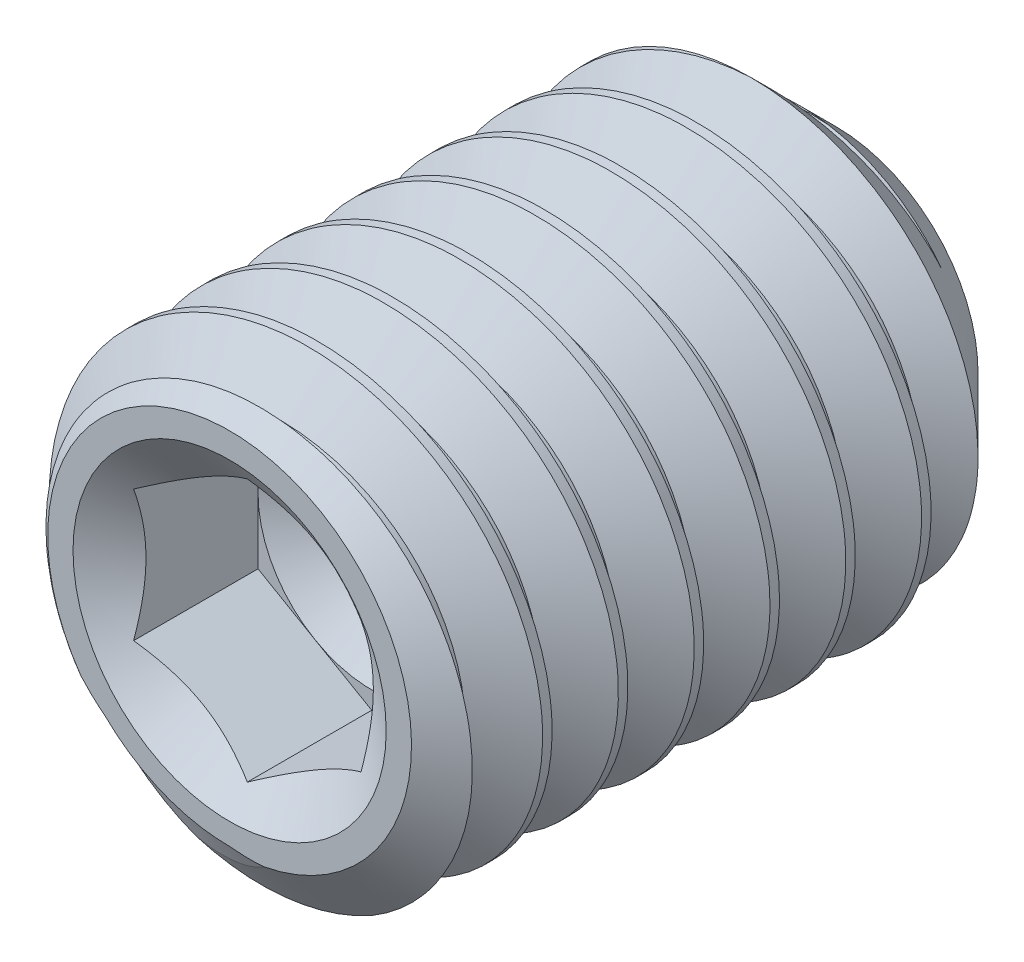
from build123d import *

# Parameters (mm, degrees)
CUT_EXTRUDE3_DEPTH = 0.9375
CUT_SWEEP1_PITCH   = 0.5


with BuildPart() as part:
    # Sketch4 → Revolve1 (revolve)
    with BuildSketch(Plane(origin=(0, 0, 0), x_dir=(0, 0, -1), z_dir=(1, 0, 0))):
        with BuildLine():
            Line((1.780834109, 0), (2.112041367, 0.551221444))
            ThreePointArc((2.112041367, 0.551221444), (2.191888731, 0.737071218), (2.219165891, 0.9375))
            Line((2.219165891, 0.9375), (1.656665891, 1.5))
            Line((1.656665891, 1.5), (-1.570771847, 1.5))
            Line((-1.570771847, 1.5), (-1.780834109, 1.2))
            Line((-1.780834109, 1.2), (-1.780834109, 0))
            Line((-1.780834109, 0), (1.780834109, 0))
        make_face()
    revolve(axis=Axis((0, 0, -1.780834109), (0, 0, 1)))

    # Sketch6 → Cut-Extrude3 (cut)
    with BuildSketch(Plane.XY.offset(1.780834109)):
        Polygon((0.75, 0.433012702), (0, 0.866025404), (-0.75, 0.433012702), (-0.75, -0.433012702), (0, -0.866025404), (0.75, -0.433012702), align=None)
    extrude(amount=-CUT_EXTRUDE3_DEPTH, mode=Mode.SUBTRACT)

    # Cut-Extrude4 cone 1 section (through the dimple's axis) → Cut-Extrude4 (revolve, cut)
    with BuildSketch(Plane(origin=(0, 0, 1.780834109), x_dir=(0, -1, 0), z_dir=(1, 0, 0))):
        Polygon((0, 0), (1.033012702, 0), (0, 0.723323281), align=None)
    revolve(axis=Axis((0, 0, 1.780834109), (0, 0, -1)), mode=Mode.SUBTRACT)

    # Cut-Extrude5 cone 1 section (through the dimple's axis) → Cut-Extrude5 (revolve, cut)
    with BuildSketch(Plane(origin=(0, 0, 0.843334109), x_dir=(0, -1, 0), z_dir=(1, 0, 0))):
        Polygon((0, 0), (0.75, 0), (0, 0.433012702), align=None)
    revolve(axis=Axis((0, 0, 0.843334109), (0, 0, -1)), mode=Mode.SUBTRACT)

    # Cut-Sweep1: the profile of Sketch10 profile screwed along a right-hand helix of 9 turns, 6 arcs to a turn; built about Z, then put on its axis
    cut_sweep1_z = Axis((0, 0, 0), (0, 0, 1))
    cut_sweep1_corners = [(1.5003, 0, 0.000173205), (1.5003, 0, -0.437673205), (1.175240474, 0, -0.25), (1.175240474, 0, -0.1875)]
    with BuildLine(mode=Mode.PRIVATE) as cut_sweep1_profile:
        Line(cut_sweep1_corners[0], cut_sweep1_corners[1])
        Line(cut_sweep1_corners[1], cut_sweep1_corners[2])
        Line(cut_sweep1_corners[2], cut_sweep1_corners[3])
        Line(cut_sweep1_corners[3], cut_sweep1_corners[0])
    cut_sweep1_cap = Face(cut_sweep1_profile.wire())
    cut_sweep1_turn_angles = [0, 30, 60, 90, 120, 150, 180, 210, 240, 270, 300, 330, 360]
    cut_sweep1_turn_weights = [1, 0.8660254037844387, 1, 0.8660254037844387, 1, 0.8660254037844387, 1, 0.8660254037844387, 1, 0.8660254037844387, 1, 0.8660254037844387, 1]
    cut_sweep1_turn_rails = [Edge.make_bspline([Vector(p[0], p[1], 0).rotate(cut_sweep1_z, cut_sweep1_turn_angles[k]) / cut_sweep1_turn_weights[k] + Vector(0, 0, p[2] + CUT_SWEEP1_PITCH * cut_sweep1_turn_angles[k] / 360) for k in range(13)], [0, 0, 0, 1, 1, 2, 2, 3, 3, 4, 4, 5, 5, 6, 6, 6], 2, cut_sweep1_turn_weights) for p in cut_sweep1_corners]
    cut_sweep1_turn_sides = [Face.make_surface_from_curves(cut_sweep1_turn_rails[p[0]], cut_sweep1_turn_rails[p[1]]) for p in [(0, 1), (1, 2), (2, 3), (3, 0)]]
    cut_sweep1 = Plane(origin=(0, 0, -2.219165891), x_dir=(0, 1, 0), z_dir=(0, 0, 1)) * Solid(Shell([*[p.moved(Location((0, 0, CUT_SWEEP1_PITCH * i))) for i in range(9) for p in cut_sweep1_turn_sides], cut_sweep1_cap, cut_sweep1_cap.rotate(cut_sweep1_z, 3240).moved(Location((0, 0, CUT_SWEEP1_PITCH * 3240 / 360)))]))
    add(cut_sweep1, mode=Mode.SUBTRACT)


solid = part.part
